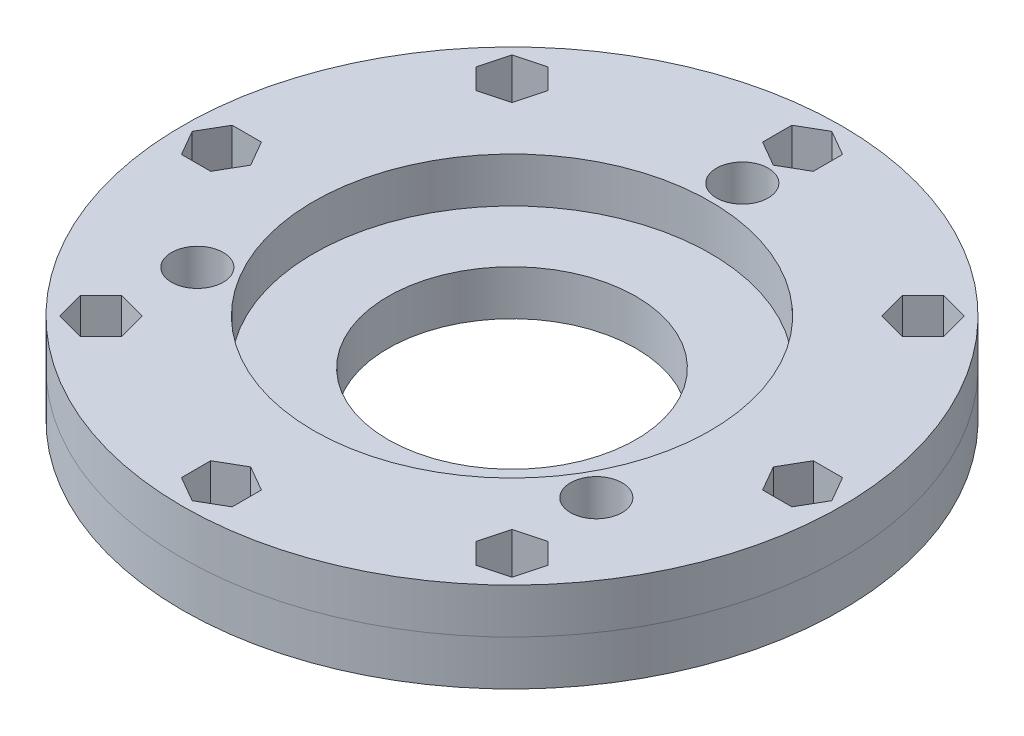
from build123d import *

# Parameters (mm, degrees)
SKETCH1_R           = 46.5
SKETCH1_R_2         = 2.25
SKETCH1_R_3         = 17.5
BOSS_EXTRUDE1_DEPTH = 12.7
SKETCH2_R           = 28
CUT_EXTRUDE1_DEPTH  = 6.35
SKETCH3_R           = 2.5
CUT_EXTRUDE2_DEPTH  = 6.35
SKETCH4_R           = 3.65
CUT_EXTRUDE3_DEPTH  = 6.35


with BuildPart() as part:
    # Sketch1 → Boss-Extrude1 (new body)
    with BuildSketch(Plane(origin=(0, 0, 0), x_dir=(1, 0, 0), z_dir=(0, 1, 0))):
        Circle(SKETCH1_R)
        with Locations((0, 32.5)):
            Circle(SKETCH1_R_2, mode=Mode.SUBTRACT)
        with Locations((28.145825623, -16.25)):
            Circle(SKETCH1_R_2, mode=Mode.SUBTRACT)
        with Locations((-28.145825623, -16.25)):
            Circle(SKETCH1_R_2, mode=Mode.SUBTRACT)
        Circle(SKETCH1_R_3, mode=Mode.SUBTRACT)
    extrude(amount=BOSS_EXTRUDE1_DEPTH)

    # Sketch2 → Cut-Extrude1 (cut)
    with BuildSketch(Plane(origin=(0, 12.7, 0), x_dir=(1, 0, 0), z_dir=(0, 1, 0))):
        Circle(SKETCH2_R)
    extrude(amount=-CUT_EXTRUDE1_DEPTH, mode=Mode.SUBTRACT)

    # Sketch3 → Cut-Extrude2 (cut)
    with BuildSketch(Plane(origin=(0, 12.7, 0), x_dir=(1, 0, 0), z_dir=(0, 1, 0))):
        with Locations((0, 41)):
            Circle(SKETCH3_R)
        with Locations((28.991378029, 28.991378029)):
            Circle(SKETCH3_R)
        with Locations((41, 0)):
            Circle(SKETCH3_R)
        with Locations((28.991378029, -28.991378029)):
            Circle(SKETCH3_R)
        with Locations((0, -41)):
            Circle(SKETCH3_R)
        with Locations((-28.991378029, -28.991378029)):
            Circle(SKETCH3_R)
        with Locations((-41, 0)):
            Circle(SKETCH3_R)
        with Locations((-28.991378029, 28.991378029)):
            Circle(SKETCH3_R)
    extrude(amount=-CUT_EXTRUDE2_DEPTH, mode=Mode.SUBTRACT)

    # Sketch4 → Cut-Extrude3 (cut)
    with BuildSketch(Plane(origin=(0, 12.7, 0), x_dir=(1, 0, 0), z_dir=(0, 1, 0))):
        with Locations((0, 32.5)):
            Circle(SKETCH4_R)
        with Locations((28.145825623, -16.25)):
            Circle(SKETCH4_R)
        with Locations((-28.145825623, -16.25)):
            Circle(SKETCH4_R)
        Polygon((0, 45.128054425), (-3.575, 43.064027212), (-3.575, 38.935972788), (0, 36.871945575), (3.575, 38.935972788), (3.575, 43.064027212), align=None)
        Polygon((32.97877241, 27.922958924), (31.910353305, 31.910353305), (27.922958924, 32.97877241), (25.003983647, 30.059797133), (26.072402752, 26.072402752), (30.059797133, 25.003983647), align=None)
        Polygon((43.064027212, -3.575), (45.128054425, 0), (43.064027212, 3.575), (38.935972788, 3.575), (36.871945575, 0), (38.935972788, -3.575), align=None)
        Polygon((27.922958924, -32.97877241), (31.910353305, -31.910353305), (32.97877241, -27.922958924), (30.059797133, -25.003983647), (26.072402752, -26.072402752), (25.003983647, -30.059797133), align=None)
        Polygon((-3.575, -43.064027212), (0, -45.128054425), (3.575, -43.064027212), (3.575, -38.935972788), (0, -36.871945575), (-3.575, -38.935972788), align=None)
        Polygon((-32.97877241, -27.922958924), (-31.910353305, -31.910353305), (-27.922958924, -32.97877241), (-25.003983647, -30.059797133), (-26.072402752, -26.072402752), (-30.059797133, -25.003983647), align=None)
        Polygon((-43.064027212, 3.575), (-45.128054425, 0), (-43.064027212, -3.575), (-38.935972788, -3.575), (-36.871945575, 0), (-38.935972788, 3.575), align=None)
        Polygon((-27.922958924, 32.97877241), (-31.910353305, 31.910353305), (-32.97877241, 27.922958924), (-30.059797133, 25.003983647), (-26.072402752, 26.072402752), (-25.003983647, 30.059797133), align=None)
    extrude(amount=-CUT_EXTRUDE3_DEPTH, mode=Mode.SUBTRACT)


with BuildPart() as body_2:
    # Split1: the piece on the far side of the plane
    add(part.part)
    split(bisect_by=Plane.ZX.offset(6.35), keep=Keep.BOTTOM)


with BuildPart() as part_1:
    add(part.part)

    # Split1
    split(bisect_by=Plane.ZX.offset(6.35), keep=Keep.TOP)


solid = Compound([body_2.part, part_1.part])
